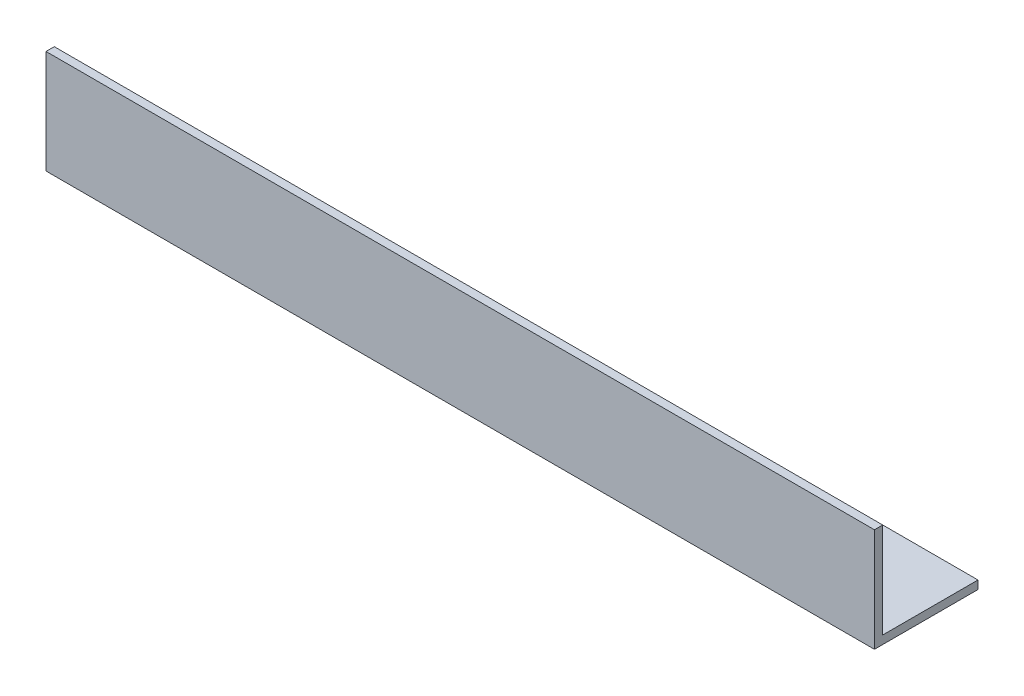
from build123d import *

# Parameters (mm, degrees)
EXTRUDE_1_DEPTH = 200


with BuildPart() as part:
    # Эскиз1 → Вытянуть-Тонкостенный1 (new body)
    with BuildSketch(Plane(origin=(0, 0, 0), x_dir=(0, 0, -1), z_dir=(1, 0, 0))):
        Polygon((0, 25), (0, 0), (25, 0), (25, 2), (2, 2), (2, 25), align=None)
    extrude(amount=EXTRUDE_1_DEPTH)


solid = part.part
